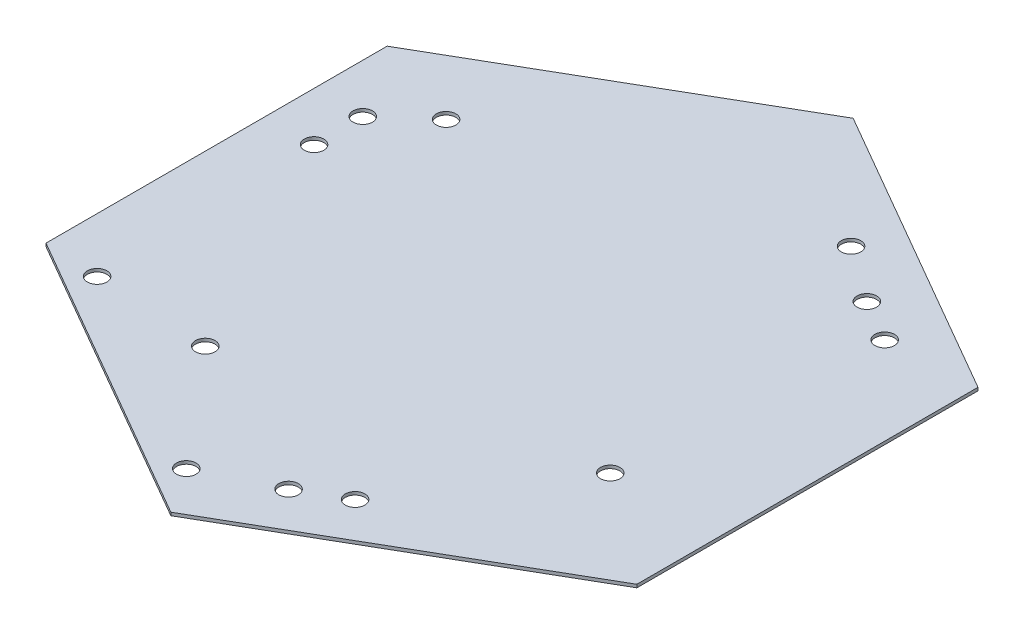
from build123d import *

# Parameters (mm, degrees)
SKETCH1_R           = 2.54
BOSS_EXTRUDE1_DEPTH = 0.8128
SKETCH2_R           = 2.54
CUT_EXTRUDE1_DEPTH  = 118.606454516
SKETCH3_R           = 2.54
CUT_EXTRUDE2_DEPTH  = 118.606454516


with BuildPart() as part:
    # Sketch1 → Boss-Extrude1 (new body)
    with BuildSketch(Plane(origin=(0, 0, 0), x_dir=(1, 0, 0), z_dir=(0, 1, 0))):
        Polygon((0, 88.9), (-76.989658396, 44.45), (-76.989658396, -44.45), (0, -88.9), (76.989658396, -44.45), (76.989658396, 44.45), align=None)
        with Locations((10.147783942, -68.376477372)):
            Circle(SKETCH1_R, mode=Mode.SUBTRACT)
        with Locations((21.14630657, -62.026477372)):
            Circle(SKETCH1_R, mode=Mode.SUBTRACT)
        with Locations((-64.289658396, 25.4)):
            Circle(SKETCH1_R, mode=Mode.SUBTRACT)
        with Locations((-64.289658396, 12.7)):
            Circle(SKETCH1_R, mode=Mode.SUBTRACT)
        with Locations((54.141874454, 42.976477372)):
            Circle(SKETCH1_R, mode=Mode.SUBTRACT)
        with Locations((43.143351826, 49.326477372)):
            Circle(SKETCH1_R, mode=Mode.SUBTRACT)
    extrude(amount=BOSS_EXTRUDE1_DEPTH)

    # Sketch2 → Cut-Extrude1 (cut, through all)
    with BuildSketch(Plane(origin=(0, 0.8128, 0), x_dir=(1, 0, 0), z_dir=(0, 1, 0))):
        with Locations((28.620590949, 59.732317666)):
            Circle(SKETCH2_R)
        with Locations((48.416295038, -22.82051708)):
            Circle(SKETCH2_R)
        with Locations((-52.77011314, 35.59948292)):
            Circle(SKETCH2_R)
        with Locations((-32.974409051, -46.953351826)):
            Circle(SKETCH2_R)
    extrude(amount=-CUT_EXTRUDE1_DEPTH, mode=Mode.SUBTRACT)

    # Sketch3 → Cut-Extrude2 (cut, through all)
    with BuildSketch(Plane(origin=(0, 0.8128, 0), x_dir=(1, 0, 0), z_dir=(0, 1, 0))):
        with Locations((-7.823522628, -77.050738686)):
            Circle(SKETCH3_R)
        with Locations((-62.816135768, -45.300738686)):
            Circle(SKETCH3_R)
    extrude(amount=-CUT_EXTRUDE2_DEPTH, mode=Mode.SUBTRACT)


solid = part.part
